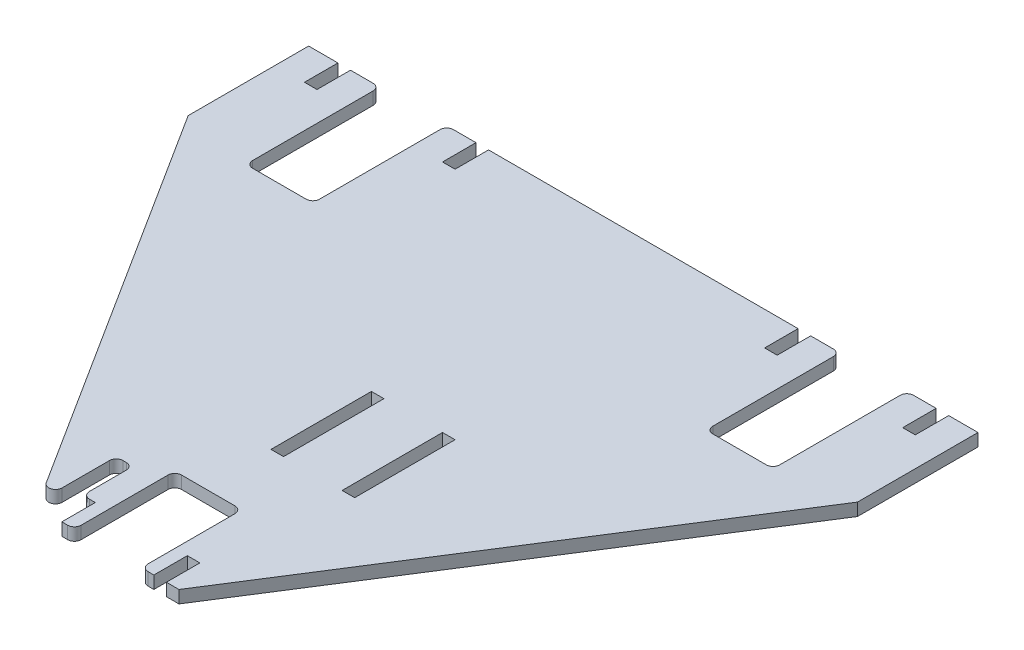
from build123d import *

# Parameters (mm, degrees)
BOSS_EXTRUDE1_DEPTH = 4.7625
SKETCH2_W           = 4.7625
SKETCH2_H           = 38.1
SKETCH2_W_2         = 6.35
SKETCH2_H_2         = 31.75
CUT_EXTRUDE1_DEPTH  = 163.709069834
FILLET1_R           = 2.54
FILLET2_R           = 2.54


with BuildPart() as part:
    # Sketch1 → Boss-Extrude1 (new body)
    with BuildSketch(Plane(origin=(0, 0, 0), x_dir=(1, 0, 0), z_dir=(0, 1, 0))):
        Polygon((12.7, -63.5), (-12.7, -63.5), (-12.7, -101.6), (-17.4625, -101.6), (-17.4625, -88.9), (-22.225, -88.9), (-22.225, -101.6), (-26.9875, -101.6), (-127, 55.88), (-127, 101.6), (-115.8875, 101.6), (-115.8875, 88.9), (-111.125, 88.9), (-111.125, 101.6), (-100.0125, 101.6), (-100.0125, 50.8), (-74.6125, 50.8), (-74.6125, 101.6), (-63.5, 101.6), (-63.5, 88.9), (-58.7375, 88.9), (-58.7375, 101.6), (58.7375, 101.6), (58.7375, 88.9), (63.5, 88.9), (63.5, 101.6), (74.6125, 101.6), (74.6125, 50.8), (100.0125, 50.8), (100.0125, 101.6), (111.125, 101.6), (111.125, 88.9), (115.8875, 88.9), (115.8875, 101.6), (127, 101.6), (127, 55.88), (26.9875, -101.6), (22.225, -101.6), (22.225, -88.9), (17.4625, -88.9), (17.4625, -101.6), (12.7, -101.6), align=None)
    extrude(amount=BOSS_EXTRUDE1_DEPTH)

    # Sketch2 → Cut-Extrude1 (cut, through all)
    with BuildSketch(Plane(origin=(0, 4.7625, 0), x_dir=(1, 0, 0), z_dir=(0, 1, 0))):
        with Locations((0.79375, -19.05)):
            Rectangle(SKETCH2_W, SKETCH2_H)
        with Locations((-25.4, -85.725)):
            Rectangle(SKETCH2_W_2, SKETCH2_H_2)
        with Locations((27.78125, -19.05)):
            Rectangle(SKETCH2_W, SKETCH2_H)
    extrude(amount=-CUT_EXTRUDE1_DEPTH, mode=Mode.SUBTRACT)

    # Fillet1
    fillet1_edges = [part.edges().sort_by_distance(p)[0] for p in [
        (-22.225, 2.38125, 88.9),
        (-28.575, 2.38125, 99.10031746),
        (-22.225, 2.38125, 69.85),
        (-28.575, 2.38125, 69.85),
    ]]
    fillet(fillet1_edges, radius=FILLET1_R)

    # Fillet2
    fillet2_edges = [part.edges().sort_by_distance(p)[0] for p in [
        (-12.7, 2.38125, 101.6),
        (12.7, 2.38125, 101.6),
        (12.7, 2.38125, 63.5),
        (-12.7, 2.38125, 63.5),
        (100.0125, 2.38125, -101.6),
        (100.0125, 2.38125, -50.8),
        (74.6125, 2.38125, -101.6),
        (74.6125, 2.38125, -50.8),
        (-100.0125, 2.38125, -101.6),
        (-74.6125, 2.38125, -101.6),
        (-74.6125, 2.38125, -50.8),
        (-100.0125, 2.38125, -50.8),
    ]]
    fillet(fillet2_edges, radius=FILLET2_R)


solid = part.part
